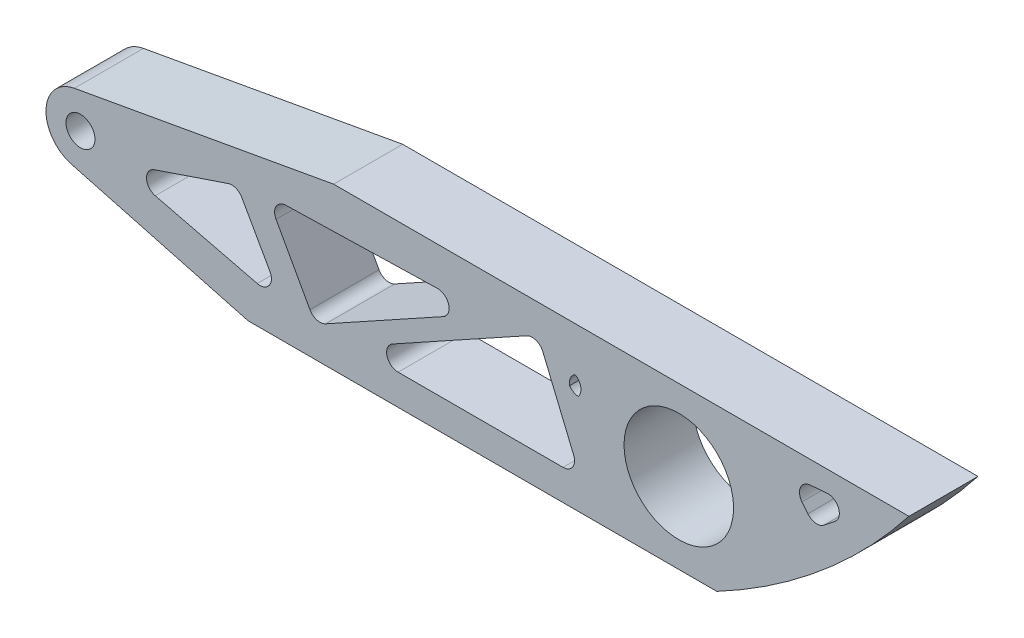
from build123d import *

# Parameters (mm, degrees)
SKETCH1_W           = 241.3
SKETCH1_H           = 44.45
BOSS_EXTRUDE1_DEPTH = 19.06
SKETCH3_R           = 4
CUT_EXTRUDE1_DEPTH  = 125.151748779
CUT_EXTRUDE2_DEPTH  = 125.151748779
SKETCH11_R          = 15.113
CUT_EXTRUDE3_DEPTH  = 125.151748779
CUT_EXTRUDE5_DEPTH  = 125.151748779
FILLET1_R           = 3.175


with BuildPart() as part:
    # Sketch1 → Boss-Extrude1 (new body)
    with BuildSketch(Plane.XY):
        Rectangle(SKETCH1_W, SKETCH1_H)
    extrude(amount=BOSS_EXTRUDE1_DEPTH)

    # Sketch3 → Cut-Extrude1 (cut, through all)
    with BuildSketch(Plane.XY.offset(19.06)):
        with Locations((-107.95, 0)):
            Circle(SKETCH3_R)
    extrude(amount=-CUT_EXTRUDE1_DEPTH, mode=Mode.SUBTRACT)

    # Sketch5 → Cut-Extrude2 (cut, through all)
    with BuildSketch(Plane.XY.offset(19.06)):
        with BuildLine():
            ThreePointArc((67.637087091, -22.225), (96.497916739, -2.807923084), (120.65, 22.225))
            Line((120.65, 22.225), (120.65, -22.225))
            Line((120.65, -22.225), (67.637087091, -22.225))
        make_face()
        with BuildLine():
            Line((-61.710210997, -22.225), (-110.410681995, -9.201666649))
            ThreePointArc((-110.410681995, -9.201666649), (-117.466687359, 0.397852617), (-109.634072253, 9.374941368))
            Line((-109.634072253, 9.374941368), (-38.1, 22.225))
            Line((-38.1, 22.225), (-120.65, 22.225))
            Line((-120.65, 22.225), (-120.65, -22.225))
            Line((-120.65, -22.225), (-61.710210997, -22.225))
        make_face()
    extrude(amount=-CUT_EXTRUDE2_DEPTH, mode=Mode.SUBTRACT)

    # Sketch11 → Cut-Extrude3 (cut, through all)
    with BuildSketch(Plane(origin=(0, 0, 0), x_dir=(-1, 0, 0), z_dir=(0, 0, -1))):
        with Locations((-57.15, 0)):
            Circle(SKETCH11_R)
    extrude(amount=-CUT_EXTRUDE3_DEPTH, mode=Mode.SUBTRACT)

    # Sketch14 → Cut-Extrude5 (cut, through all)
    with BuildSketch(Plane.XY.offset(19.06)):
        Polygon((87.427282936, 15.558708401), (94.741989073, 6.41532573), (108.43714596, 17.350301349), align=None)
        Polygon((18.258483502, 14.338005817), (29.973493873, -13.800738505), (-32.606529101, -13.800738505), align=None)
        Polygon((-43.100879601, -13.800738505), (3.468328331, 11.961548148), (-56.519992491, 10.456326363), align=None)
        Polygon((-64.730780564, 8.662121496), (-52.068091334, -13.800738505), (-97.910045601, -2.558530136), align=None)
        Polygon((25.377220315, 10.456326363), (27.958556135, 4.256114298), (42.851089432, 10.456326363), align=None)
    extrude(amount=-CUT_EXTRUDE5_DEPTH, mode=Mode.SUBTRACT)

    # Fillet1
    # the kernel refuses this fillet: 3.175 mm, written as the material it adds along each edge
    with BuildSketch(Plane(origin=(-64.730780564, 8.662121496, 19.06), x_dir=(-0.9472961687281491, -0.32035912459764615, 0), z_dir=(0, 0, -1))) as fillet1_piece_1:
        with BuildLine():
            CenterArc((FILLET1_R * 0.828359701977, -FILLET1_R), FILLET1_R, 90, 79.273962625)
            Line((-FILLET1_R * 0.154168619156, -FILLET1_R * 0.813886867277), (0, 0))
            Line((0, 0), (FILLET1_R * 0.828359701977, 0))
        make_face()
    extrude(amount=19.06)
    with BuildSketch(Plane(origin=(-52.068091334, -13.800738505, 19.06), x_dir=(-0.9712208651423397, 0.23818066905642277, 0), z_dir=(0, 0, -1))) as fillet1_piece_2:
        with BuildLine():
            CenterArc((FILLET1_R * 2.310303232, FILLET1_R), FILLET1_R, 136.810131201, 133.189868799)
            Line((FILLET1_R * 1.58121357242, FILLET1_R * 1.68441819694), (0, 0))
            Line((0, 0), (FILLET1_R * 2.310303232, 0))
        make_face()
    extrude(amount=19.06)
    with BuildSketch(Plane(origin=(-97.910045601, -2.558530136, 19.06), x_dir=(0.9472961687281494, 0.32035912459764504, 0), z_dir=(0, 0, -1))) as fillet1_piece_3:
        with BuildLine():
            CenterArc((FILLET1_R * 3.43487976267, FILLET1_R), FILLET1_R, 122.463831423, 147.536168577)
            Line((FILLET1_R * 2.89811266126, FILLET1_R * 1.8437304539), (0, 0))
            Line((0, 0), (FILLET1_R * 3.43487976267, 0))
        make_face()
    extrude(amount=19.06)
    with BuildSketch(Plane(origin=(-56.519992491, 10.456326363, 19.06), x_dir=(0.9996853464994547, 0.025084018702456384, 0), z_dir=(0, 0, -1))) as fillet1_piece_4:
        with BuildLine():
            CenterArc((FILLET1_R * 1.64840949376, FILLET1_R), FILLET1_R, 152.485801408, 117.514198592)
            Line((FILLET1_R * 0.761513114746, FILLET1_R * 1.46196841114), (0, 0))
            Line((0, 0), (FILLET1_R * 1.64840949376, 0))
        make_face()
    extrude(amount=19.06)
    with BuildSketch(Plane(origin=(3.468328331, 11.961548148, 19.06), x_dir=(-0.8750292896969416, -0.48406997652453715, 0), z_dir=(0, 0, -1))) as fillet1_piece_5:
        with BuildLine():
            CenterArc((FILLET1_R * 4.08447056876, FILLET1_R), FILLET1_R, 117.514198592, 152.485801408)
            Line((FILLET1_R * 3.62250215761, FILLET1_R * 1.88689637901), (0, 0))
            Line((0, 0), (FILLET1_R * 4.08447056876, 0))
        make_face()
    extrude(amount=19.06)
    with BuildSketch(Plane(origin=(-43.100879601, -13.800738505, 19.06), x_dir=(0.8750292896969416, 0.48406997652453704, 0), z_dir=(0, 0, -1))) as fillet1_piece_6:
        with BuildLine():
            CenterArc((FILLET1_R, -FILLET1_R), FILLET1_R, 90, 90)
            Line((0, -FILLET1_R), (0, 0))
            Line((0, 0), (FILLET1_R, 0))
        make_face()
    extrude(amount=19.06)
    with BuildSketch(Plane(origin=(-32.606529101, -13.800738505, 19.06), x_dir=(0.8750292896969417, 0.48406997652453687, 0), z_dir=(0, 0, -1))) as fillet1_piece_7:
        with BuildLine():
            CenterArc((FILLET1_R * 3.87346743369, FILLET1_R), FILLET1_R, 118.951557757, 151.048442243)
            Line((FILLET1_R * 3.38939745717, FILLET1_R * 1.8750292897), (0, 0))
            Line((0, 0), (FILLET1_R * 3.87346743369, 0))
        make_face()
    extrude(amount=19.06)
    with BuildSketch(Plane(origin=(18.258483502, 14.338005817, 19.06), x_dir=(-0.8750292896969422, -0.4840699765245361, 0), z_dir=(0, 0, -1))) as fillet1_piece_8:
        with BuildLine():
            CenterArc((FILLET1_R * 1.11742055595, -FILLET1_R), FILLET1_R, 90, 96.348118808)
            Line((FILLET1_R * 0.123552109362, -FILLET1_R * 1.11056903214), (0, 0))
            Line((0, 0), (FILLET1_R * 1.11742055595, 0))
        make_face()
    extrude(amount=19.06)
    with BuildSketch(Plane(origin=(29.973493873, -13.800738505, 19.06), x_dir=(-1, 0, 0), z_dir=(0, 0, -1))) as fillet1_piece_9:
        with BuildLine():
            CenterArc((FILLET1_R * 1.49953423253, FILLET1_R), FILLET1_R, 157.396561051, 112.603438949)
            Line((FILLET1_R * 0.576347082868, FILLET1_R * 1.38435073396), (0, 0))
            Line((0, 0), (FILLET1_R * 1.49953423253, 0))
        make_face()
    extrude(amount=19.06)
    with BuildSketch(Plane(origin=(87.427282936, 15.558708401, 19.06), x_dir=(0.6246950475544248, -0.7808688094430298, 0), z_dir=(0, 0, -1))) as fillet1_piece_10:
        with BuildLine():
            CenterArc((FILLET1_R * 1.87227376636, -FILLET1_R), FILLET1_R, 90, 123.785764981)
            Line((FILLET1_R * 1.04115111223, -FILLET1_R * 1.55608914195), (0, 0))
            Line((0, 0), (FILLET1_R * 1.87227376636, 0))
        make_face()
    extrude(amount=19.06)
    with BuildSketch(Plane(origin=(108.43714596, 17.350301349, 19.06), x_dir=(-0.7814571605260681, -0.6239588978951538, 0), z_dir=(0, 0, -1))) as fillet1_piece_11:
        with BuildLine():
            CenterArc((FILLET1_R * 3.2984470476, FILLET1_R), FILLET1_R, 123.731770788, 146.268229212)
            Line((FILLET1_R * 2.74314138288, FILLET1_R * 1.83164633032), (0, 0))
            Line((0, 0), (FILLET1_R * 3.2984470476, 0))
        make_face()
    extrude(amount=19.06)
    with BuildSketch(Plane(origin=(94.741989073, 6.41532573, 19.06), x_dir=(-0.6246950475544234, 0.7808688094430309, 0), z_dir=(0, 0, -1))) as fillet1_piece_12:
        with BuildLine():
            CenterArc((FILLET1_R * 0.999058067303, FILLET1_R), FILLET1_R, 180.053994194, 89.946005806)
            Line((-FILLET1_R * 0.000941488660736, FILLET1_R * 0.999057623684), (0, 0))
            Line((0, 0), (FILLET1_R * 0.999058067303, 0))
        make_face()
    extrude(amount=19.06)
    with BuildSketch(Plane(origin=(27.958556135, 4.256114298, 19.06), x_dir=(-0.3843507339571626, 0.9231871496650018, 0), z_dir=(0, 0, -1))) as fillet1_piece_13:
        with BuildLine():
            CenterArc((FILLET1_R, FILLET1_R), FILLET1_R, 180, 90)
            Line((0, FILLET1_R), (0, 0))
            Line((0, 0), (FILLET1_R, 0))
        make_face()
    extrude(amount=19.06)
    with BuildSketch(Plane(origin=(42.851089432, 10.456326363, 19.06), x_dir=(-0.9231871496650015, -0.3843507339571632, 0), z_dir=(0, 0, -1))) as fillet1_piece_14:
        with BuildLine():
            CenterArc((FILLET1_R * 5.003729614, FILLET1_R), FILLET1_R, 112.603438949, 157.396561051)
            Line((FILLET1_R * 4.61937888005, FILLET1_R * 1.92318714967), (0, 0))
            Line((0, 0), (FILLET1_R * 5.003729614, 0))
        make_face()
    extrude(amount=19.06)
    with BuildSketch(Plane(origin=(25.377220315, 10.456326363, 19.06), x_dir=(0.3843507339571629, -0.9231871496650017, 0), z_dir=(0, 0, -1))) as fillet1_piece_15:
        with BuildLine():
            CenterArc((FILLET1_R * 1.49953423253, -FILLET1_R), FILLET1_R, 90, 112.603438949)
            Line((FILLET1_R * 0.576347082868, -FILLET1_R * 1.38435073396), (0, 0))
            Line((0, 0), (FILLET1_R * 1.49953423253, 0))
        make_face()
    extrude(amount=19.06)


solid = part.part
